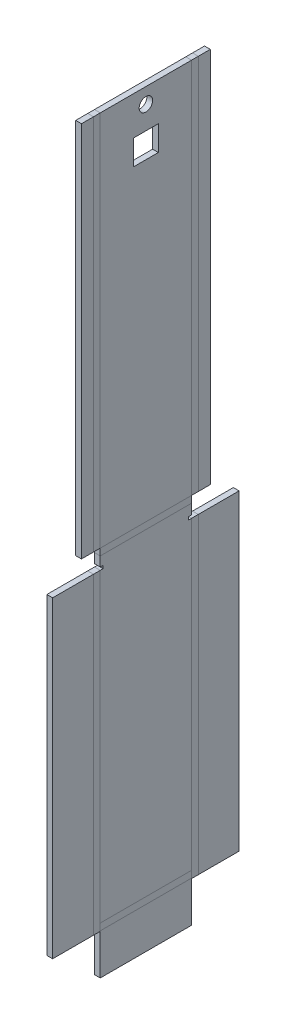
from build123d import *

# Parameters (mm, degrees)
SKETCH1_W                     = 170
SKETCH1_H                     = 55
BASE_FLANGE1_DEPTH            = 3
EDGE_FLANGE1_STRIP_W          = 13.4732
EDGE_FLANGE1_STRIP_H          = 3
EDGE_FLANGE1_STRIP_CUT_DEPTH  = 162.776884107
EDGE_FLANGE1_RELIEF_W         = 14.9732
EDGE_FLANGE1_RELIEF_H         = 1.5
EDGE_FLANGE1_RELIEF_CUT_DEPTH = 3
EDGE_FLANGE1_DEPTH            = 162.776884107
EDGE_FLANGE2_STRIP_W          = 13.4732
EDGE_FLANGE2_STRIP_H          = 3
EDGE_FLANGE2_STRIP_CUT_DEPTH  = 162.461666913
EDGE_FLANGE2_RELIEF_W         = 14.9732
EDGE_FLANGE2_RELIEF_H         = 1.5
EDGE_FLANGE2_RELIEF_CUT_DEPTH = 3
EDGE_FLANGE2_DEPTH            = 162.461666913
EDGE_FLANGE3_STRIP_W          = 13.4732
EDGE_FLANGE3_STRIP_H          = 3
EDGE_FLANGE3_STRIP_CUT_DEPTH  = 47.5268
EDGE_FLANGE3_DEPTH            = 47.5268
EDGE_FLANGE4_STRIP_W          = 13.4732
EDGE_FLANGE4_STRIP_H          = 3
EDGE_FLANGE4_STRIP_CUT_DEPTH  = 55
EDGE_FLANGE4_DEPTH            = 55
EDGE_FLANGE5_STRIP_W          = 13.4732
EDGE_FLANGE5_STRIP_H          = 3
EDGE_FLANGE5_STRIP_CUT_DEPTH  = 196.2634
EDGE_FLANGE5_DEPTH            = 196.2634
EDGE_FLANGE6_STRIP_W          = 13.4732
EDGE_FLANGE6_STRIP_H          = 3
EDGE_FLANGE6_STRIP_CUT_DEPTH  = 196.2634
EDGE_FLANGE6_DEPTH            = 196.2634
SKETCH27_R                    = 3.5
SKETCH27_W                    = 13
SKETCH27_H                    = 13
CUT_EXTRUDE1_DEPTH            = 10
UNFOLD1_START                 = -85
UNFOLD1_DEPTH                 = 170
UNFOLD1_START_2               = 85
UNFOLD1_2_DEPTH               = 3
SKETCH28_W                    = 4.727050269
SKETCH28_H                    = 8.499758958
CUT_EXTRUDE2_DEPTH            = 10
SKETCH29_W                    = 4.501036857
SKETCH29_H                    = 9.383895171
CUT_EXTRUDE3_DEPTH            = 10
FOLD2_START                   = -193.080086129
FOLD2_OUTLINE_W               = 3
FOLD2_OUTLINE_H               = 97.08008613
FOLD2_DEPTH                   = 190.080086129
FOLD2_START_2                 = 0.7366
FOLD2_2_DEPTH                 = 196.2634
FOLD2_START_3                 = -2.776643065
FOLD2_3_DEPTH                 = 2.776643065
FOLD2_4_OUTLINE_W             = 162.776884107
FOLD2_4_OUTLINE_H             = 3
FOLD2_4_OUTLINE_W_2           = 162.461666913
FOLD2_4_DEPTH                 = 21.2634
FOLD2_START_4                 = 22
FOLD2_5_DEPTH                 = 175
FOLD2_START_5                 = 87.103787073
FOLD2_6_OUTLINE_W             = 0.223356935
FOLD2_6_OUTLINE_H             = 47.5268
FOLD2_6_DEPTH                 = 1.896212927
FOLD2_START_6                 = -85
FOLD2_7_DEPTH                 = 162.461666913
FOLD2_START_7                 = -106.040043065
FOLD2_8_OUTLINE_W             = 0.223356935
FOLD2_8_OUTLINE_H             = 47.5268
FOLD2_8_DEPTH                 = 21.040043065
FOLD2_START_8                 = 79.276884107
FOLD2_9_OUTLINE_W             = 0.223356935
FOLD2_9_OUTLINE_H             = 47.5268
FOLD2_9_DEPTH                 = 4.986515893
FOLD2_START_9                 = 77.461666913
FOLD2_10_DEPTH                = 0.315217194
FOLD2_START_10                = -23.7634
FOLD2_11_DEPTH                = 47.5268
FOLD2_START_11                = -22.2634
FOLD2_12_OUTLINE_W            = 1.815217194
FOLD2_12_OUTLINE_H            = 0.223356935
FOLD2_12_DEPTH                = 44.5268
FOLD2_13_DEPTH                = 47.5268
FOLD2_14_OUTLINE_W            = 0.315217194
FOLD2_14_OUTLINE_H            = 0.223356935
FOLD2_14_DEPTH                = 46.0268
FOLD2_15_OUTLINE_W            = 0.315217194
FOLD2_15_OUTLINE_H            = 0.223356935
FOLD2_15_DEPTH                = 46.0268
FOLD3_START                   = -23.7634
FOLD3_DEPTH                   = 47.5268
FOLD3_2_DEPTH                 = 47.5268
UNFOLD2_START                 = -85
UNFOLD2_DEPTH                 = 170
UNFOLD2_START_2               = 85
UNFOLD2_2_OUTLINE_W           = 196.2634
UNFOLD2_2_OUTLINE_H           = 9.776643065
UNFOLD2_2_DEPTH               = 3


with BuildPart() as part:
    # Base-Flange1: sheet metal written as solids
    # Sketch1 → Base-Flange1 (new body)
    with BuildSketch(Plane(origin=(0, 0, 0), x_dir=(1, 0, 0), z_dir=(0, 1, 0))):
        Rectangle(SKETCH1_W, SKETCH1_H)
    extrude(amount=-BASE_FLANGE1_DEPTH)

    # Edge-Flange1: sheet metal written as solids
    # Edge-Flange1 strip (on a plane across the edge) → Edge-Flange1 strip cut (cut)
    with BuildSketch(Plane(origin=(-85, 0, 27.5), x_dir=(0, 0, -1), z_dir=(1, 0, 0))):
        with Locations((-3, -1.5)):
            Rectangle(EDGE_FLANGE1_STRIP_W, EDGE_FLANGE1_STRIP_H)
    extrude(amount=EDGE_FLANGE1_STRIP_CUT_DEPTH, mode=Mode.SUBTRACT)

    # Edge-Flange1 relief (on the sheet) → Edge-Flange1 relief cut (cut)
    with BuildSketch(Plane(origin=(-85, 0, 23.7634), x_dir=(0, 0, -1), z_dir=(0, 1, 0))):
        with Locations((-5.9866, -163.526884107)):
            Rectangle(EDGE_FLANGE1_RELIEF_W, EDGE_FLANGE1_RELIEF_H)
    extrude(amount=-EDGE_FLANGE1_RELIEF_CUT_DEPTH, mode=Mode.SUBTRACT)

    # Edge-Flange1 section (on a plane across the edge) → Edge-Flange1 (add)
    with BuildSketch(Plane(origin=(-85, 0, 27.5), x_dir=(0, 0, -1), z_dir=(1, 0, 0))):
        with BuildLine():
            Line((0, 0.7366), (0, 22))
            Line((0, 22), (3, 22))
            Line((3, 22), (3, 0.7366))
            ThreePointArc((3, 0.7366), (3.215745145, 0.215745145), (3.7366, 0))
            Line((3.7366, 0), (3.7366, -3))
            ThreePointArc((3.7366, -3), (1.094424801, -1.905575199), (0, 0.7366))
        make_face()
    extrude(amount=EDGE_FLANGE1_DEPTH)

    # Edge-Flange2: sheet metal written as solids
    # Edge-Flange2 strip (on a plane across the edge) → Edge-Flange2 strip cut (cut)
    with BuildSketch(Plane(origin=(77.461666913, 0, -27.5), x_dir=(0, 0, 1), z_dir=(-1, 0, 0))):
        with Locations((-3, -1.5)):
            Rectangle(EDGE_FLANGE2_STRIP_W, EDGE_FLANGE2_STRIP_H)
    extrude(amount=EDGE_FLANGE2_STRIP_CUT_DEPTH, mode=Mode.SUBTRACT)

    # Edge-Flange2 relief (on the sheet) → Edge-Flange2 relief cut (cut)
    with BuildSketch(Plane(origin=(77.461666913, 0, -23.7634), x_dir=(0, 0, 1), z_dir=(0, 1, 0))):
        with Locations((-5.9866, 0.75)):
            Rectangle(EDGE_FLANGE2_RELIEF_W, EDGE_FLANGE2_RELIEF_H)
    extrude(amount=-EDGE_FLANGE2_RELIEF_CUT_DEPTH, mode=Mode.SUBTRACT)

    # Edge-Flange2 section (on a plane across the edge) → Edge-Flange2 (add)
    with BuildSketch(Plane(origin=(77.461666913, 0, -27.5), x_dir=(0, 0, 1), z_dir=(-1, 0, 0))):
        with BuildLine():
            Line((0, 0.7366), (0, 22))
            Line((0, 22), (3, 22))
            Line((3, 22), (3, 0.7366))
            ThreePointArc((3, 0.7366), (3.215745145, 0.215745145), (3.7366, 0))
            Line((3.7366, 0), (3.7366, -3))
            ThreePointArc((3.7366, -3), (1.094424801, -1.905575199), (0, 0.7366))
        make_face()
    extrude(amount=EDGE_FLANGE2_DEPTH)

    # Edge-Flange3: sheet metal written as solids
    # Edge-Flange3 strip (on a plane across the edge) → Edge-Flange3 strip cut (cut)
    with BuildSketch(Plane(origin=(-85, 0, -23.7634), x_dir=(1, 0, 0), z_dir=(0, 0, 1))):
        with Locations((-3, -1.5)):
            Rectangle(EDGE_FLANGE3_STRIP_W, EDGE_FLANGE3_STRIP_H)
    extrude(amount=EDGE_FLANGE3_STRIP_CUT_DEPTH, mode=Mode.SUBTRACT)

    # Edge-Flange3 section (on a plane across the edge) → Edge-Flange3 (add)
    with BuildSketch(Plane(origin=(-85, 0, -23.7634), x_dir=(1, 0, 0), z_dir=(0, 0, 1))):
        with BuildLine():
            Line((0, 0.7366), (0, 22))
            Line((0, 22), (3, 22))
            Line((3, 22), (3, 0.7366))
            ThreePointArc((3, 0.7366), (3.215745145, 0.215745145), (3.7366, 0))
            Line((3.7366, 0), (3.7366, -3))
            ThreePointArc((3.7366, -3), (1.094424801, -1.905575199), (0, 0.7366))
        make_face()
    extrude(amount=EDGE_FLANGE3_DEPTH)

    # Edge-Flange4: sheet metal written as solids
    # Edge-Flange4 strip (on a plane across the edge) → Edge-Flange4 strip cut (cut)
    with BuildSketch(Plane(origin=(85, 0, 27.5), x_dir=(-1, 0, 0), z_dir=(0, 0, -1))):
        with Locations((-6, -1.5)):
            Rectangle(EDGE_FLANGE4_STRIP_W, EDGE_FLANGE4_STRIP_H)
    extrude(amount=EDGE_FLANGE4_STRIP_CUT_DEPTH, mode=Mode.SUBTRACT)

    # Edge-Flange4 section (on a plane across the edge) → Edge-Flange4 (add)
    with BuildSketch(Plane(origin=(85, 0, 27.5), x_dir=(-1, 0, 0), z_dir=(0, 0, -1))):
        with BuildLine():
            Line((-3, 0.7366), (-3, 197))
            Line((-3, 197), (0, 197))
            Line((0, 197), (0, 0.7366))
            ThreePointArc((0, 0.7366), (0.215745145, 0.215745145), (0.7366, 0))
            Line((0.7366, 0), (0.7366, -3))
            ThreePointArc((0.7366, -3), (-1.905575199, -1.905575199), (-3, 0.7366))
        make_face()
    extrude(amount=EDGE_FLANGE4_DEPTH)

    # Edge-Flange5: sheet metal written as solids
    # Edge-Flange5 strip (on a plane across the edge) → Edge-Flange5 strip cut (cut)
    with BuildSketch(Plane(origin=(85, 0.7366, 27.5), x_dir=(0, 0, -1), z_dir=(0, 1, 0))):
        with Locations((-3, -1.5)):
            Rectangle(EDGE_FLANGE5_STRIP_W, EDGE_FLANGE5_STRIP_H)
    extrude(amount=EDGE_FLANGE5_STRIP_CUT_DEPTH, mode=Mode.SUBTRACT)

    # Edge-Flange5 section (on a plane across the edge) → Edge-Flange5 (add)
    with BuildSketch(Plane(origin=(85, 0.7366, 27.5), x_dir=(0, 0, -1), z_dir=(0, 1, 0))):
        with BuildLine():
            Line((0, 0.7366), (0, 7))
            Line((0, 7), (3, 7))
            Line((3, 7), (3, 0.7366))
            ThreePointArc((3, 0.7366), (3.215745145, 0.215745145), (3.7366, 0))
            Line((3.7366, 0), (3.7366, -3))
            ThreePointArc((3.7366, -3), (1.094424801, -1.905575199), (0, 0.7366))
        make_face()
    extrude(amount=EDGE_FLANGE5_DEPTH)

    # Edge-Flange6: sheet metal written as solids
    # Edge-Flange6 strip (on a plane across the edge) → Edge-Flange6 strip cut (cut)
    with BuildSketch(Plane(origin=(85, 197, -27.5), x_dir=(0, 0, 1), z_dir=(0, -1, 0))):
        with Locations((-3, -1.5)):
            Rectangle(EDGE_FLANGE6_STRIP_W, EDGE_FLANGE6_STRIP_H)
    extrude(amount=EDGE_FLANGE6_STRIP_CUT_DEPTH, mode=Mode.SUBTRACT)

    # Edge-Flange6 section (on a plane across the edge) → Edge-Flange6 (add)
    with BuildSketch(Plane(origin=(85, 197, -27.5), x_dir=(0, 0, 1), z_dir=(0, -1, 0))):
        with BuildLine():
            Line((0, 0.7366), (0, 7))
            Line((0, 7), (3, 7))
            Line((3, 7), (3, 0.7366))
            ThreePointArc((3, 0.7366), (3.215745145, 0.215745145), (3.7366, 0))
            Line((3.7366, 0), (3.7366, -3))
            ThreePointArc((3.7366, -3), (1.094424801, -1.905575199), (0, 0.7366))
        make_face()
    extrude(amount=EDGE_FLANGE6_DEPTH)

    # Sketch27 → Cut-Extrude1 (cut)
    with BuildSketch(Plane(origin=(88, 0, 0), x_dir=(0, 0, -1), z_dir=(1, 0, 0))):
        with Locations(Location((0, 189, 0), (0, 0, 90))):
            Circle(SKETCH27_R)
        with Locations((0, 170.5)):
            Rectangle(SKETCH27_W, SKETCH27_H)
    extrude(amount=-CUT_EXTRUDE1_DEPTH, mode=Mode.SUBTRACT)

    # Unfold1: read off the stored shape, not the designer's step
    # Unfold1 outline → Unfold1 (cut)
    with BuildSketch(Plane.YZ.offset(UNFOLD1_START)):
        Polygon((197, -27.5), (197, -23.7634), (22, -23.7634), (22, 23.7634), (197, 23.7634), (197, 27.5), (-7.763158958, 27.5), (-7.763158958, 22.2634), (-9.263158958, 22.2634), (-9.263158958, 23.7634), (-168.303443065, 23.7634), (-168.303443065, -23.7634), (-9.578376152, -23.7634), (-9.578376152, -22.2634), (-8.078376152, -22.2634), (-8.078376152, -27.5), align=None)
    extrude(amount=UNFOLD1_DEPTH, mode=Mode.SUBTRACT)

    # Unfold1 2 outline → Unfold1 2 (add)
    with BuildSketch(Plane.YZ.offset(UNFOLD1_START_2)):
        Polygon((0.7366, -27.5), (0.7366, -33.540043065), (197, -33.540043065), (197, -23.7634), (0.7366, -23.7634), (0.7366, 23.7634), (197, 23.7634), (197, 33.540043065), (0.7366, 33.540043065), (0.7366, 27.5), (-7.763158958, 27.5), (-7.763158958, 22.2634), (-9.263158958, 22.2634), (-9.263158958, 48.540043065), (-172.040043065, 48.540043065), (-172.040043065, 23.7634), (-193.080086129, 23.7634), (-193.080086129, -23.7634), (-172.040043065, -23.7634), (-172.040043065, -48.540043065), (-9.578376152, -48.540043065), (-9.578376152, -22.2634), (-8.078376152, -22.2634), (-8.078376152, -27.5), align=None)
    extrude(amount=UNFOLD1_2_DEPTH)

    # Sketch28 → Cut-Extrude2 (cut)
    with BuildSketch(Plane(origin=(88, 0, 0), x_dir=(0, 0, -1), z_dir=(1, 0, 0))):
        with Locations((-26.126925134, -3.513279479)):
            Rectangle(SKETCH28_W, SKETCH28_H)
    extrude(amount=-CUT_EXTRUDE2_DEPTH, mode=Mode.SUBTRACT)

    # Sketch29 → Cut-Extrude3 (cut)
    with BuildSketch(Plane(origin=(88, 0, 0), x_dir=(0, 0, -1), z_dir=(1, 0, 0))):
        with Locations((26.013918429, -3.955347585)):
            Rectangle(SKETCH29_W, SKETCH29_H)
    extrude(amount=-CUT_EXTRUDE3_DEPTH, mode=Mode.SUBTRACT)

    # Fold2: read off the stored shape, not the designer's step
    # Fold2 outline → Fold2 (cut)
    with BuildSketch(Plane(origin=(0, 0, 0), x_dir=(1, 0, 0), z_dir=(0, 1, 0)).offset(FOLD2_START)):
        with Locations((86.5, 0)):
            Rectangle(FOLD2_OUTLINE_W, FOLD2_OUTLINE_H)
    extrude(amount=FOLD2_DEPTH, mode=Mode.SUBTRACT)

    # Fold2 2 outline → Fold2 2 (cut)
    with BuildSketch(Plane(origin=(0, 0, 0), x_dir=(1, 0, 0), z_dir=(0, 1, 0)).offset(FOLD2_START_2)):
        with BuildLine():
            Line((88, -33.540043065), (88, -23.7634))
            ThreePointArc((88, -23.7634), (87.154295979, -26.130867001), (85, -27.426677222))
            Line((85, -27.426677222), (85, -33.540043065))
            Line((85, -33.540043065), (88, -33.540043065))
        make_face()
        with BuildLine():
            ThreePointArc((85, 27.426677222), (87.154295979, 26.130867001), (88, 23.7634))
            Line((88, 23.7634), (88, 33.540043065))
            Line((88, 33.540043065), (85, 33.540043065))
            Line((85, 33.540043065), (85, 27.426677222))
        make_face()
    extrude(amount=FOLD2_2_DEPTH, mode=Mode.SUBTRACT)

    # Fold2 3 outline → Fold2 3 (add)
    with BuildSketch(Plane(origin=(0, 0, 0), x_dir=(1, 0, 0), z_dir=(0, 1, 0)).offset(FOLD2_START_3)):
        Polygon((77.776884107, -22.2634), (79.276884107, -22.2634), (79.276884107, -23.7634), (85, -23.7634), (85, 23.7634), (78.961666913, 23.7634), (78.961666913, 22.2634), (77.461666913, 22.2634), (77.461666913, 24.5), (-85, 24.5), (-85, 23.7634), (-106.040043065, 23.7634), (-106.040043065, -23.7634), (-85, -23.7634), (-85, -24.5), (77.776884107, -24.5), align=None)
    extrude(amount=FOLD2_3_DEPTH)

    # Fold2 4 outline → Fold2 4 (add)
    with BuildSketch(Plane(origin=(0, 0, 0), x_dir=(1, 0, 0), z_dir=(0, 1, 0)).offset(FOLD2_START_2)):
        with BuildLine():
            Line((85, -27.426677222), (85, -23.7634))
            ThreePointArc((85, -23.7634), (84.784254855, -24.284254855), (84.2634, -24.5))
            Line((84.2634, -24.5), (78, -24.5))
            Line((78, -24.5), (78, -27.5))
            Line((78, -27.5), (84.2634, -27.5))
            ThreePointArc((84.2634, -27.5), (84.63352018, -27.481624121), (85, -27.426677222))
        make_face()
        with Locations((-3.611557946, -26)):
            Rectangle(FOLD2_4_OUTLINE_W, FOLD2_4_OUTLINE_H)
        with BuildLine():
            ThreePointArc((84.2634, 24.5), (84.784254855, 24.284254855), (85, 23.7634))
            Line((85, 23.7634), (85, 27.426677222))
            ThreePointArc((85, 27.426677222), (84.63352018, 27.481624121), (84.2634, 27.5))
            Line((84.2634, 27.5), (78, 27.5))
            Line((78, 27.5), (78, 24.5))
            Line((78, 24.5), (84.2634, 24.5))
        make_face()
        with Locations((-3.769166543, 26)):
            Rectangle(FOLD2_4_OUTLINE_W_2, FOLD2_4_OUTLINE_H)
    extrude(amount=FOLD2_4_DEPTH)

    # Fold2 5 outline → Fold2 5 (add)
    with BuildSketch(Plane(origin=(0, 0, 0), x_dir=(1, 0, 0), z_dir=(0, 1, 0)).offset(FOLD2_START_4)):
        with BuildLine():
            Line((85, -27.426677222), (85, -23.7634))
            ThreePointArc((85, -23.7634), (84.784254855, -24.284254855), (84.2634, -24.5))
            Line((84.2634, -24.5), (78, -24.5))
            Line((78, -24.5), (78, -27.5))
            Line((78, -27.5), (84.2634, -27.5))
            ThreePointArc((84.2634, -27.5), (84.63352018, -27.481624121), (85, -27.426677222))
        make_face()
        with BuildLine():
            ThreePointArc((84.2634, 24.5), (84.784254855, 24.284254855), (85, 23.7634))
            Line((85, 23.7634), (85, 27.426677222))
            ThreePointArc((85, 27.426677222), (84.63352018, 27.481624121), (84.2634, 27.5))
            Line((84.2634, 27.5), (78, 27.5))
            Line((78, 27.5), (78, 24.5))
            Line((78, 24.5), (84.2634, 24.5))
        make_face()
    extrude(amount=FOLD2_5_DEPTH)

    # Fold2 6 outline → Fold2 6 (cut)
    with BuildSketch(Plane.YZ.offset(FOLD2_START_5)):
        with Locations((-2.888321533, 0)):
            Rectangle(FOLD2_6_OUTLINE_W, FOLD2_6_OUTLINE_H)
    extrude(amount=FOLD2_6_DEPTH, mode=Mode.SUBTRACT)

    # Fold2 7 outline → Fold2 7 (add)
    with BuildSketch(Plane.YZ.offset(FOLD2_START_6)):
        with BuildLine():
            Line((0, -23.7634), (-2.776643065, -23.7634))
            Line((-2.776643065, -23.7634), (-2.776643065, 23.7634))
            Line((-2.776643065, 23.7634), (0, 23.7634))
            ThreePointArc((0, 23.7634), (0.215745145, 24.284254855), (0.7366, 24.5))
            Line((0.7366, 24.5), (0.7366, 27.5))
            ThreePointArc((0.7366, 27.5), (-1.905575199, 26.405575199), (-3, 23.7634))
            Line((-3, 23.7634), (-3, -23.7634))
            ThreePointArc((-3, -23.7634), (-1.905575199, -26.405575199), (0.7366, -27.5))
            Line((0.7366, -27.5), (0.7366, -24.5))
            ThreePointArc((0.7366, -24.5), (0.215745145, -24.284254855), (0, -23.7634))
        make_face()
    extrude(amount=FOLD2_7_DEPTH)

    # Fold2 8 outline → Fold2 8 (add)
    with BuildSketch(Plane.YZ.offset(FOLD2_START_7)):
        with Locations((-2.888321533, 0)):
            Rectangle(FOLD2_8_OUTLINE_W, FOLD2_8_OUTLINE_H)
    extrude(amount=FOLD2_8_DEPTH)

    # Fold2 9 outline → Fold2 9 (add)
    with BuildSketch(Plane.YZ.offset(FOLD2_START_8)):
        with Locations((-2.888321533, 0)):
            Rectangle(FOLD2_9_OUTLINE_W, FOLD2_9_OUTLINE_H)
    extrude(amount=FOLD2_9_DEPTH)

    # Fold2 10 outline → Fold2 10 (add)
    with BuildSketch(Plane.YZ.offset(FOLD2_START_9)):
        with BuildLine():
            ThreePointArc((0.7366, 27.5), (-1.905575199, 26.405575199), (-3, 23.7634))
            Line((-3, 23.7634), (-2.776643065, 23.7634))
            Line((-2.776643065, 23.7634), (0, 23.7634))
            ThreePointArc((0, 23.7634), (0.215745145, 24.284254855), (0.7366, 24.5))
            Line((0.7366, 24.5), (0.7366, 27.5))
        make_face()
    extrude(amount=FOLD2_10_DEPTH)

    # Fold2 11 outline → Fold2 11 (cut)
    with BuildSketch(Plane.XY.offset(FOLD2_START_10)):
        with BuildLine():
            Line((88, -2.776643065), (88, 0.7366))
            ThreePointArc((88, 0.7366), (87.154295979, -1.630867001), (85, -2.926677222))
            Line((85, -2.926677222), (85, -3))
            Line((85, -3), (87.103787073, -3))
            Line((87.103787073, -3), (87.103787073, -2.776643065))
            Line((87.103787073, -2.776643065), (88, -2.776643065))
        make_face()
    extrude(amount=FOLD2_11_DEPTH, mode=Mode.SUBTRACT)

    # Fold2 12 outline → Fold2 12 (add)
    with BuildSketch(Plane.XY.offset(FOLD2_START_11)):
        with BuildLine():
            ThreePointArc((85, 0.7366), (84.784254855, 0.215745145), (84.2634, 0))
            Line((84.2634, 0), (85, 0))
            Line((85, 0), (85, 0.7366))
        make_face()
        with Locations((78.36927551, -2.888321533)):
            Rectangle(FOLD2_12_OUTLINE_W, FOLD2_12_OUTLINE_H)
        with BuildLine():
            ThreePointArc((84.2634, -3), (84.63352018, -2.981624121), (85, -2.926677222))
            Line((85, -2.926677222), (85, -2.776643065))
            Line((85, -2.776643065), (84.2634, -2.776643065))
            Line((84.2634, -2.776643065), (84.2634, -3))
        make_face()
    extrude(amount=FOLD2_12_DEPTH)

    # Fold2 13 outline → Fold2 13 (add)
    with BuildSketch(Plane.XY.offset(FOLD2_START_10)):
        with BuildLine():
            ThreePointArc((85, 0.7366), (84.784254855, 0.215745145), (84.2634, 0))
            Line((84.2634, 0), (85, 0))
            Line((85, 0), (85, 0.7366))
        make_face()
        with BuildLine():
            ThreePointArc((84.2634, -3), (84.63352018, -2.981624121), (85, -2.926677222))
            Line((85, -2.926677222), (85, -2.776643065))
            Line((85, -2.776643065), (84.2634, -2.776643065))
            Line((84.2634, -2.776643065), (84.2634, -3))
        make_face()
    extrude(amount=FOLD2_13_DEPTH)

    # Fold2 14 outline → Fold2 14 (add)
    with BuildSketch(Plane.XY.offset(FOLD2_START_10)):
        with Locations((79.11927551, -2.888321533)):
            Rectangle(FOLD2_14_OUTLINE_W, FOLD2_14_OUTLINE_H)
    extrude(amount=FOLD2_14_DEPTH)

    # Fold2 15 outline → Fold2 15 (add)
    with BuildSketch(Plane.XY.offset(FOLD2_START_11)):
        with Locations((77.61927551, -2.888321533)):
            Rectangle(FOLD2_15_OUTLINE_W, FOLD2_15_OUTLINE_H)
    extrude(amount=FOLD2_15_DEPTH)

    # Fold3: read off the stored shape, not the designer's step
    # Fold3 outline → Fold3 (cut)
    with BuildSketch(Plane.XY.offset(FOLD3_START)):
        with BuildLine():
            ThreePointArc((-81.2634, -3), (-83.630867001, -2.154295979), (-84.926677222, 0))
            Line((-84.926677222, 0), (-106.040043065, 0))
            Line((-106.040043065, 0), (-106.040043065, -3))
            Line((-106.040043065, -3), (-81.2634, -3))
        make_face()
    extrude(amount=FOLD3_DEPTH, mode=Mode.SUBTRACT)

    # Fold3 2 outline → Fold3 2 (add)
    with BuildSketch(Plane.XY.offset(FOLD3_START)):
        with BuildLine():
            Line((-85, 22), (-85, 0.7366))
            ThreePointArc((-85, 0.7366), (-84.981624121, 0.36647982), (-84.926677222, 0))
            Line((-84.926677222, 0), (-81.2634, 0))
            ThreePointArc((-81.2634, 0), (-81.784254855, 0.215745145), (-82, 0.7366))
            Line((-82, 0.7366), (-82, 22))
            Line((-82, 22), (-85, 22))
        make_face()
    extrude(amount=FOLD3_2_DEPTH)

    # Unfold2: read off the stored shape, not the designer's step
    # Unfold2 outline → Unfold2 (cut)
    with BuildSketch(Plane.YZ.offset(UNFOLD2_START)):
        with BuildLine():
            Line((-9.578376152, -22.2634), (-8.078376152, -22.2634))
            Line((-8.078376152, -22.2634), (-8.078376152, -23.7634))
            Line((-8.078376152, -23.7634), (-3, -23.7634))
            ThreePointArc((-3, -23.7634), (-1.905575199, -26.405575199), (0.7366, -27.5))
            Line((0.7366, -27.5), (197, -27.5))
            Line((197, -27.5), (197, -23.7634))
            Line((197, -23.7634), (22, -23.7634))
            Line((22, -23.7634), (22, 23.7634))
            Line((22, 23.7634), (197, 23.7634))
            Line((197, 23.7634), (197, 27.5))
            Line((197, 27.5), (0.7366, 27.5))
            ThreePointArc((0.7366, 27.5), (-1.905575199, 26.405575199), (-3, 23.7634))
            Line((-3, 23.7634), (-7.763158958, 23.7634))
            Line((-7.763158958, 23.7634), (-7.763158958, 22.2634))
            Line((-7.763158958, 22.2634), (-9.263158958, 22.2634))
            Line((-9.263158958, 22.2634), (-9.263158958, 23.7634))
            Line((-9.263158958, 23.7634), (-168.303443065, 23.7634))
            Line((-168.303443065, 23.7634), (-168.303443065, -23.7634))
            Line((-168.303443065, -23.7634), (-9.578376152, -23.7634))
            Line((-9.578376152, -23.7634), (-9.578376152, -22.2634))
        make_face()
        with BuildLine():
            Line((0.7366, 23.7634), (0, 23.7634))
            ThreePointArc((0, 23.7634), (0.215745145, 24.284254855), (0.7366, 24.5))
            Line((0.7366, 24.5), (0.7366, 23.7634))
        make_face(mode=Mode.SUBTRACT)
        with BuildLine():
            Line((0, -23.7634), (0.7366, -23.7634))
            Line((0.7366, -23.7634), (0.7366, -24.5))
            ThreePointArc((0.7366, -24.5), (0.215745145, -24.284254855), (0, -23.7634))
        make_face(mode=Mode.SUBTRACT)
    extrude(amount=UNFOLD2_DEPTH, mode=Mode.SUBTRACT)

    # Unfold2 2 outline → Unfold2 2 (add)
    with BuildSketch(Plane.YZ.offset(UNFOLD2_START_2)):
        Polygon((-9.578376152, -22.2634), (-8.078376152, -22.2634), (-8.078376152, -23.7634), (0.7366, -23.7634), (0.7366, 23.7634), (-7.763158958, 23.7634), (-7.763158958, 22.2634), (-9.263158958, 22.2634), (-9.263158958, 48.540043065), (-172.040043065, 48.540043065), (-172.040043065, 23.7634), (-193.080086129, 23.7634), (-193.080086129, -23.7634), (-172.040043065, -23.7634), (-172.040043065, -48.540043065), (-9.578376152, -48.540043065), align=None)
        with Locations((98.8683, -28.651721532)):
            Rectangle(UNFOLD2_2_OUTLINE_W, UNFOLD2_2_OUTLINE_H)
        with Locations((98.8683, 28.651721532)):
            Rectangle(UNFOLD2_2_OUTLINE_W, UNFOLD2_2_OUTLINE_H)
    extrude(amount=UNFOLD2_2_DEPTH)


solid = part.part
